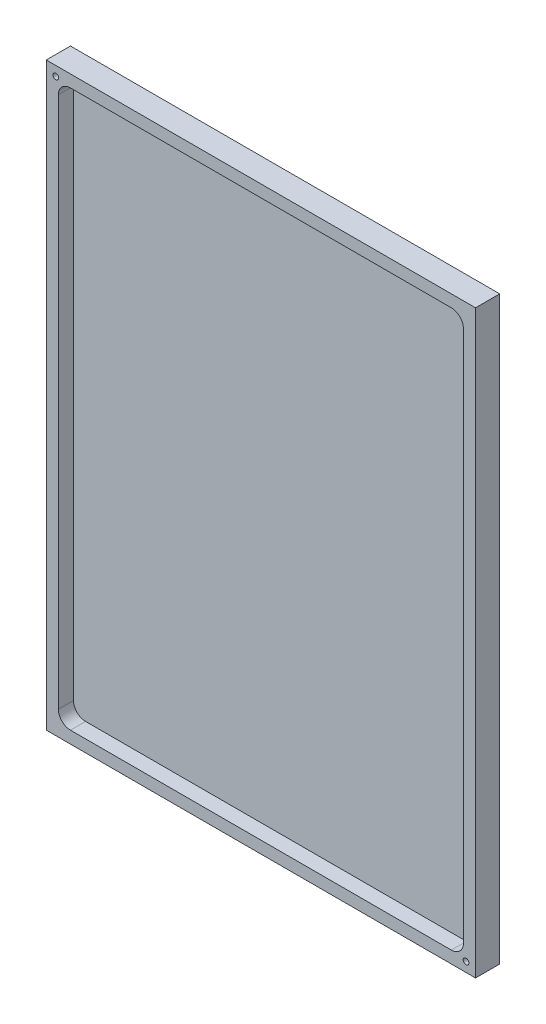
from build123d import *

# Parameters (mm, degrees)
SKETCH1_W                    = 225.425
SKETCH1_H                    = 304.8
BOSS_EXTRUDE1_DEPTH          = 12.7
CUT_EXTRUDE1_DEPTH           = 7.9375
F_3_0_3_DIAMETER_HOLE1_D     = 3
F_3_0_3_DIAMETER_HOLE1_DEPTH = 5
F_3_0_3_DIAMETER_HOLE1_TIP   = 0.901290929


with BuildPart() as part:
    # Sketch1 → Boss-Extrude1 (new body)
    with BuildSketch(Plane.XY):
        Rectangle(SKETCH1_W, SKETCH1_H)
    extrude(amount=BOSS_EXTRUDE1_DEPTH)

    # Sketch2 → Cut-Extrude1 (cut)
    with BuildSketch(Plane.XY.offset(12.7)):
        with BuildLine():
            Line((100.0125, -146.05), (-100.0125, -146.05))
            ThreePointArc((-100.0125, -146.05), (-104.502628061, -144.190128061), (-106.3625, -139.7))
            Line((-106.3625, -139.7), (-106.3625, 139.7))
            ThreePointArc((-106.3625, 139.7), (-104.502628061, 144.190128061), (-100.0125, 146.05))
            Line((-100.0125, 146.05), (100.0125, 146.05))
            ThreePointArc((100.0125, 146.05), (104.502628061, 144.190128061), (106.3625, 139.7))
            Line((106.3625, 139.7), (106.3625, -139.7))
            ThreePointArc((106.3625, -139.7), (104.502628061, -144.190128061), (100.0125, -146.05))
        make_face()
    extrude(amount=-CUT_EXTRUDE1_DEPTH, mode=Mode.SUBTRACT)

    # Ø3.0 (3) Diameter Hole1
    with Locations(Plane(origin=(-107.7125, 147.4, 12.7), x_dir=(1, 0, 0), z_dir=(0, 0, 1))):
        with Locations((0, 0), (215.425, -294.8)):
            Hole(F_3_0_3_DIAMETER_HOLE1_D / 2, depth=F_3_0_3_DIAMETER_HOLE1_DEPTH)
            with Locations((0, 0, -(F_3_0_3_DIAMETER_HOLE1_DEPTH + F_3_0_3_DIAMETER_HOLE1_TIP / 2))):  # 118° drill point
                Cone(0, F_3_0_3_DIAMETER_HOLE1_D / 2, F_3_0_3_DIAMETER_HOLE1_TIP, mode=Mode.SUBTRACT)


solid = part.part
